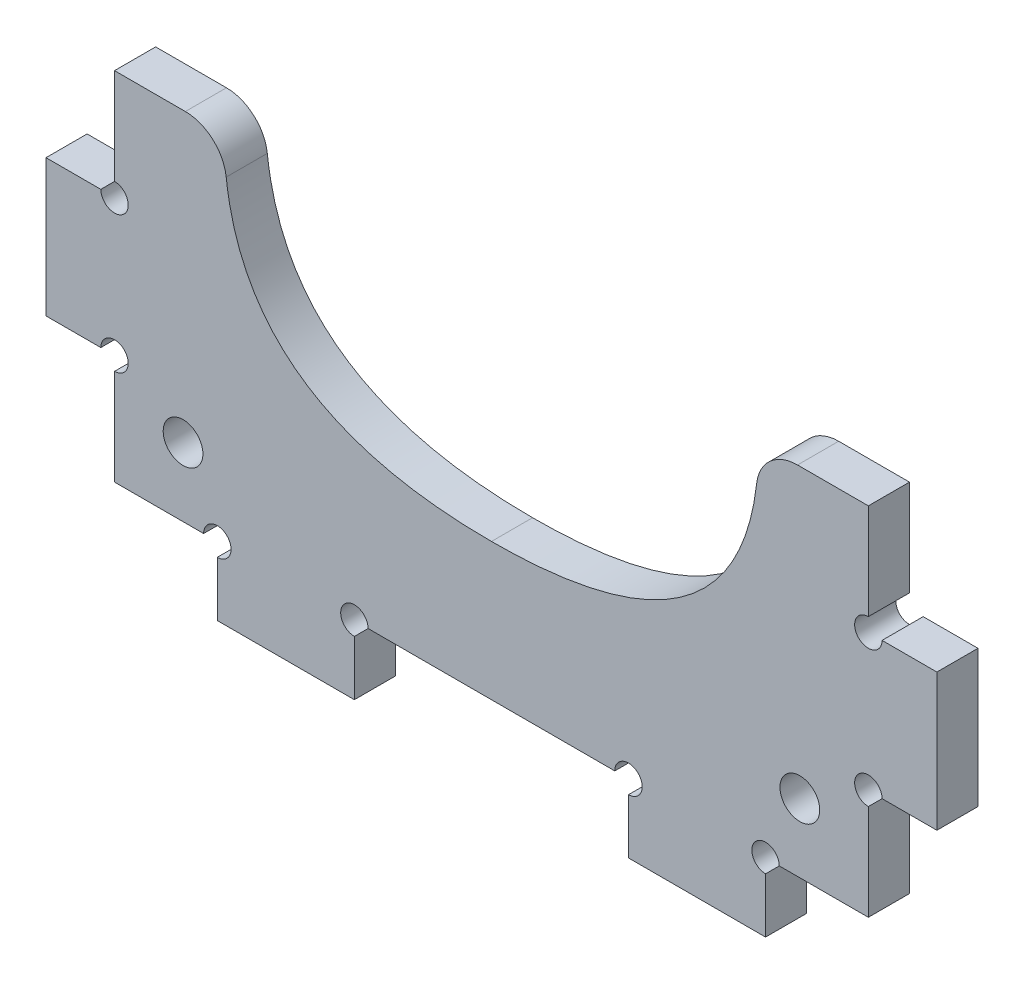
from build123d import *

# Parameters (mm, degrees)
EXTRUDE_1_OUTLINE_R = 1.45
EXTRUDE_1_DEPTH     = 3
SKETCH_2_R          = 1
CUT_EXTRUDE_1_DEPTH = 42.728287915
FILLET_1_R          = 3


# Read off the part's stored shape, not the designer's step: 凸台-拉伸1
with BuildPart() as part:
    # 凸台-拉伸1 outline → 凸台-拉伸1 (new body)
    with BuildSketch(Plane.XY):
        with BuildLine():
            Line((32.5, 8), (32.5, 18))
            Line((32.5, 18), (27.5, 18))
            Line((27.5, 18), (27.5, 26))
            Line((27.5, 26), (19.5, 26))
            add(Edge.make_bspline(
                [(19.5, 26), (19.5, 10), (-19.5, 10), (-19.5, 26)],
                knots=[0, 0, 0, 1, 2, 2, 2], degree=2))
            Line((-19.5, 26), (-27.5, 26))
            Line((-27.5, 26), (-27.5, 18))
            Line((-27.5, 18), (-32.5, 18))
            Line((-32.5, 18), (-32.5, 8))
            Line((-32.5, 8), (-27.5, 8))
            Line((-27.5, 8), (-27.5, 0))
            Line((-27.5, 0), (-20, 0))
            Line((-20, 0), (-20, -5))
            Line((-20, -5), (-10, -5))
            Line((-10, -5), (-10, 0))
            Line((-10, 0), (10, 0))
            Line((10, 0), (10, -5))
            Line((10, -5), (20, -5))
            Line((20, -5), (20, 0))
            Line((20, 0), (27.5, 0))
            Line((27.5, 0), (27.5, 8))
            Line((27.5, 8), (32.5, 8))
        make_face()
        with Locations((-22.5, 5)):
            Circle(EXTRUDE_1_OUTLINE_R, mode=Mode.SUBTRACT)
        with Locations((22.5, 5)):
            Circle(EXTRUDE_1_OUTLINE_R, mode=Mode.SUBTRACT)
    extrude(amount=EXTRUDE_1_DEPTH)

    # 草图2 → 切除-拉伸1 (cut, through all)
    with BuildSketch(Plane.XY.offset(3)):
        with Locations((-27.5, 18)):
            Circle(SKETCH_2_R)
        with Locations((-27.5, 8)):
            Circle(SKETCH_2_R)
        with Locations((-20, 0)):
            Circle(SKETCH_2_R)
        with Locations((-10, 0)):
            Circle(SKETCH_2_R)
        with Locations((10, 0)):
            Circle(SKETCH_2_R)
        with Locations((20, 0)):
            Circle(SKETCH_2_R)
        with Locations((27.5, 8)):
            Circle(SKETCH_2_R)
        with Locations((27.5, 18)):
            Circle(SKETCH_2_R)
    extrude(amount=-CUT_EXTRUDE_1_DEPTH, mode=Mode.SUBTRACT)

    # 圆角1
    fillet_1_edges = [part.edges().sort_by_distance(p)[0] for p in [
        (19.5, 26, 1.5),
        (-19.5, 26, 1.5),
    ]]
    fillet(fillet_1_edges, radius=FILLET_1_R)


solid = part.part
